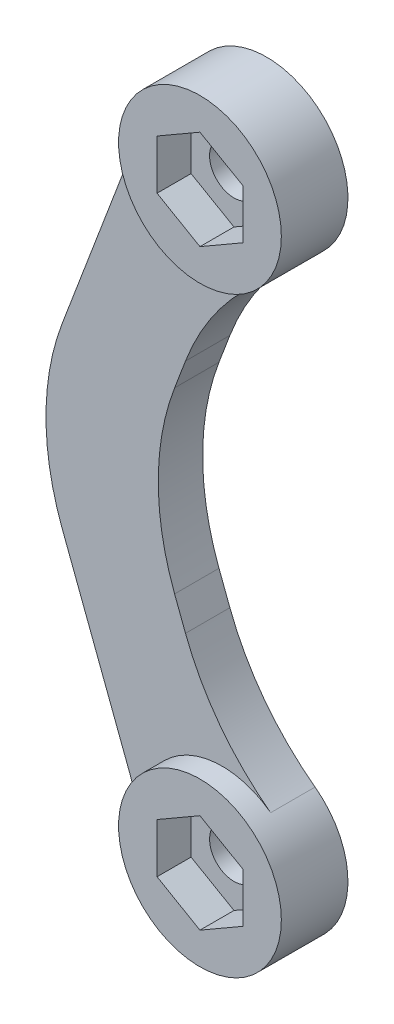
from build123d import *

# Parameters (mm, degrees)
SKETCH_1_R          = 1.65
EXTRUDE_1_DEPTH     = 3
SKETCH_2_R          = 5.5
EXTRUDE_2_DEPTH     = 1.5
CUT_EXTRUDE_1_DEPTH = 0.8
FILLET_1_R          = 17


with BuildPart() as part:
    # 草图1 → 凸台-拉伸1 (new body)
    with BuildSketch(Plane.XY):
        with BuildLine():
            Line((-5.08774827, -1.216070925), (0.41225173, -15.716070925))
            ThreePointArc((0.41225173, -15.716070925), (4.301339026, -25.105158222), (-5.08774827, -21.216070925))
            Line((-5.08774827, -21.216070925), (-12.673955167, -1.216070925))
            Line((-12.673955167, -1.216070925), (-5.08774827, 18.783929075))
            ThreePointArc((-5.08774827, 18.783929075), (4.301339026, 22.673016371), (0.41225173, 13.283929075))
            Line((0.41225173, 13.283929075), (-5.08774827, -1.216070925))
        make_face()
        with Locations((0.41225173, -21.216070925)):
            Circle(SKETCH_1_R, mode=Mode.SUBTRACT)
        with Locations(Location((0.41225173, 18.783929075, 0), (0, 0, 180))):
            Circle(SKETCH_1_R, mode=Mode.SUBTRACT)
    extrude(amount=EXTRUDE_1_DEPTH)

    # 草图2 → 凸台-拉伸2 (add)
    # profile 1 of 2: a face of its own
    with BuildSketch(Plane.XY.offset(3)):
        with Locations(Location((0.41225173, 18.783929075, 0), (0, 0, 180))):
            Circle(SKETCH_2_R)
        Polygon((-2.48774827, 20.458244856), (-2.48774827, 17.109613294), (0.41225173, 15.435297514), (3.31225173, 17.109613294), (3.31225173, 20.458244856), (0.41225173, 22.132560636), align=None, mode=Mode.SUBTRACT)
    # profile 2 of 2: a face of its own
    with BuildSketch(Plane.XY.offset(3)):
        with Locations(Location((0.41225173, -21.216070925, 0), (0, 0, 180))):
            Circle(SKETCH_2_R)
        Polygon((-2.48774827, -19.541755144), (-2.48774827, -22.890386706), (0.41225173, -24.564702486), (3.31225173, -22.890386706), (3.31225173, -19.541755144), (0.41225173, -17.867439364), align=None, mode=Mode.SUBTRACT)
    extrude(amount=EXTRUDE_2_DEPTH)

    # 草图3 → 切除-拉伸1 (cut)
    with BuildSketch(Plane.XY.offset(3)):
        Polygon((0.41225173, 22.132560636), (-2.48774827, 20.458244856), (-2.48774827, 17.109613294), (0.41225173, 15.435297514), (3.31225173, 17.109613294), (3.31225173, 20.458244856), align=None)
        Polygon((0.41225173, -17.867439364), (-2.48774827, -19.541755144), (-2.48774827, -22.890386706), (0.41225173, -24.564702486), (3.31225173, -22.890386706), (3.31225173, -19.541755144), align=None)
    extrude(amount=-CUT_EXTRUDE_1_DEPTH, mode=Mode.SUBTRACT)

    # 圆角1
    # the kernel refuses this fillet: 17 mm, written as the material it adds along each edge
    with BuildSketch(Plane(origin=(-5.08774827, 18.783929075, 0), x_dir=(0.09189054947258435, 0.9957691132574993, 0), z_dir=(0, 0, 1))) as fillet_1_piece_1:
        with BuildLine():
            CenterArc((2.572935385, 16.928074925), FILLET_1_R, 254.500123691, 10.227497936)
            Line((-1.970081643, 0.546347413), (0, 0))
            ThreePointArc((0, 0), (0.505398022, 0.023269877), (1.010796044, 0))
        make_face()
    extrude(amount=3)
    with BuildSketch(Plane(origin=(0.41225173, 13.283929075, 0), x_dir=(-0.3546542341205386, -0.9349975263177835, 0), z_dir=(0, 0, 1))) as fillet_1_piece_2:
        with BuildLine():
            CenterArc((6.987015843, 17), FILLET_1_R, 237.378356152, 32.621643848)
            ThreePointArc((-2.177496959, 2.681770183), (-0.872736529, 1.516278705), (0, 0))
            Line((0, 0), (6.987015843, 0))
        make_face()
    extrude(amount=3)
    with BuildSketch(Plane(origin=(-5.08774827, -1.216070925, 0), x_dir=(0.35465423412053854, 0.9349975263177835, 0), z_dir=(0, 0, 1))) as fillet_1_piece_3:
        with BuildLine():
            CenterArc((FILLET_1_R * 0.379310344828, -FILLET_1_R), FILLET_1_R, 90, 41.544509364)
            Line((-FILLET_1_R * 0.283891318374, -FILLET_1_R * 0.251559251559), (0, 0))
            Line((0, 0), (FILLET_1_R * 0.379310344828, 0))
        make_face()
    extrude(amount=3)
    with BuildSketch(Plane(origin=(0.41225173, -15.716070925, 0), x_dir=(-0.35465423412053854, 0.9349975263177834, 0), z_dir=(0, 0, 1))) as fillet_1_piece_4:
        with BuildLine():
            CenterArc((6.987015843, -17), FILLET_1_R, 90, 32.621643848)
            ThreePointArc((-2.177496959, -2.681770183), (-0.872736529, -1.516278705), (0, 0))
            Line((0, 0), (6.987015843, 0))
        make_face()
    extrude(amount=3)
    with BuildSketch(Plane(origin=(-5.08774827, -21.216070925, 0), x_dir=(0.09189054947258435, -0.9957691132574993, 0), z_dir=(0, 0, 1))) as fillet_1_piece_5:
        with BuildLine():
            CenterArc((2.572935385, -16.928074925), FILLET_1_R, 95.272378373, 10.227497936)
            Line((-1.970081643, -0.546347413), (0, 0))
            ThreePointArc((0, 0), (0.505398022, -0.023269877), (1.010796044, 0))
        make_face()
    extrude(amount=3)
    # the kernel refuses this fillet: 17 mm, written as the material it takes off along each edge
    with BuildSketch(Plane(origin=(-12.673955167, -1.216070925, -16.120689655), x_dir=(0.35465423412053854, 0.9349975263177835, 0), z_dir=(0, 0, 1))) as fillet_1_2_piece_1:
        with BuildLine():
            CenterArc((FILLET_1_R * 0.379310344828, -FILLET_1_R), FILLET_1_R, 90, 41.544509364)
            Line((-FILLET_1_R * 0.283891318374, -FILLET_1_R * 0.251559251559), (0, 0))
            Line((0, 0), (FILLET_1_R * 0.379310344828, 0))
        make_face()
    extrude(amount=35.24137931, mode=Mode.SUBTRACT)


solid = part.part
